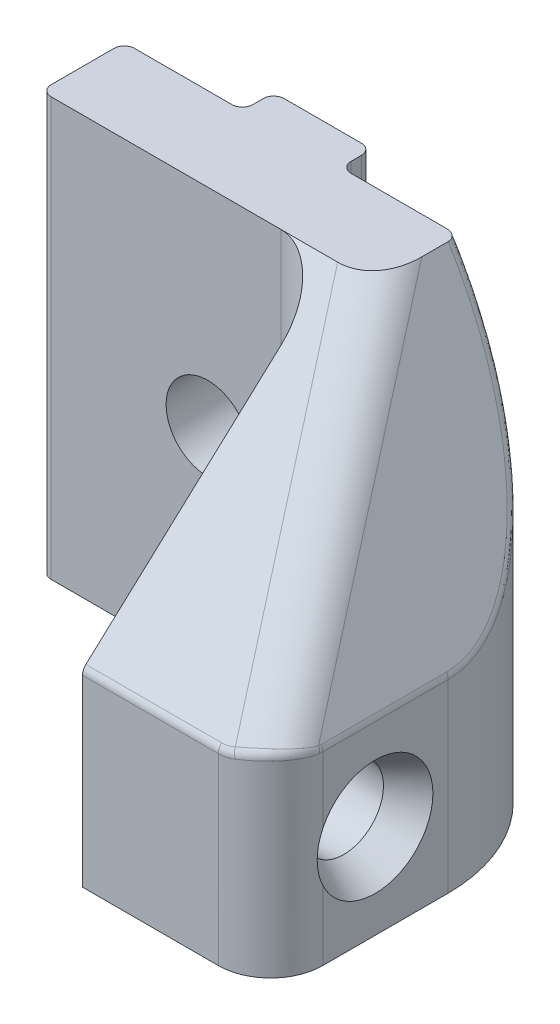
from build123d import *

# Parameters (mm, degrees)
BOSS_EXTRU_1_DEPTH           = 10
ENL_V_MAT_EXTRU_1_DEPTH      = 25.98113298
ENL_V_MAT_EXTRU_1_DEPTH_BACK = 25.98113298
ESQUISSE2_R                  = 2
ESQUISSE3_R                  = 1.55
ENL_V_MAT_EXTRU_2_DEPTH      = 24.494680249
ENL_V_START                  = -4
ESQUISSE4_R                  = 1.9
ENL_V_MAT_EXTRU_3_DEPTH      = 20.494680249
CHANFREIN1_SIZE              = 1.5
CHANFREIN1_SIZE2             = 0.866025404
CONG_1_R                     = 0.5
CONG_2_R                     = 2.5
CONG_3_R                     = 7.5
CONG_4_R                     = 0.5


with BuildPart() as part:
    # Esquisse1 → Boss.-Extru.1 (new, symmetric)
    with BuildSketch(Plane(origin=(0, 0, 0), x_dir=(1, 0, 0), z_dir=(0, 1, 0))):
        Polygon((2.35, 0), (15, 0), (15, -16), (6, -16), (6, -4), (-8, -4), (-8, 0), (-2.35, 0), (-2.35, 1.5), (2.35, 1.5), align=None)
    extrude(amount=BOSS_EXTRU_1_DEPTH, both=True)

    # Esquisse2 → Enlèv. mat.-Extru.1 (cut, two sides: drawn at the far end of the back side and taken through both)
    with BuildSketch(Plane(origin=(-1.372446517, 0, 0), x_dir=(1, 0, 0), z_dir=(0, 0, 1)).offset(-ENL_V_MAT_EXTRU_1_DEPTH_BACK)):
        with Locations((1.372446517, 0)):
            Circle(ESQUISSE2_R)
        Polygon((9.372446517, 10), (16.372446517, -1), (16.372446517, 10), align=None)
    extrude(amount=ENL_V_MAT_EXTRU_1_DEPTH + ENL_V_MAT_EXTRU_1_DEPTH_BACK, mode=Mode.SUBTRACT)

    # Esquisse3 → Enlèv. mat.-Extru.2 (cut, through all)
    with BuildSketch(Plane.ZY.offset(-6)):
        with Locations((11, -5.5)):
            Circle(ESQUISSE3_R)
        Polygon((16, 10), (16, -1), (4, 10), align=None)
    extrude(amount=-ENL_V_MAT_EXTRU_2_DEPTH, mode=Mode.SUBTRACT)

    # Esquisse4 → Enlèv. mat.-Extru.3 (cut, through all)
    with BuildSketch(Plane.ZY.offset(-6).offset(ENL_V_START)):
        with Locations((11, -5.5)):
            Circle(ESQUISSE4_R)
    extrude(amount=-ENL_V_MAT_EXTRU_3_DEPTH, mode=Mode.SUBTRACT)

    # Chanfrein1
    chanfrein1_edges = [part.edges().sort_by_distance(p)[0] for p in [
        (15, -5.5, 9.1),
    ]]
    chanfrein1_side = [part.faces().sort_by_distance(p)[0] for p in [
        (12.5, -5.5, 9.1),
    ]]
    chamfer(chanfrein1_edges, length=CHANFREIN1_SIZE, length2=CHANFREIN1_SIZE2, reference=chanfrein1_side[0])

    # Congé1
    # the kernel refuses this fillet: 0.5 mm, written as the material it adds along each edge
    with BuildSketch(Plane(origin=(2.35, -10, 0), x_dir=(1, 0, 0), z_dir=(0, 1, 0)), Plane(origin=(-2.35, 10, 0), x_dir=(-1, 0, 0), z_dir=(0, -1, 0))) as cong_1_piece_1:
        with BuildLine():
            CenterArc((CONG_1_R, CONG_1_R), CONG_1_R, 180, 90)
            Line((0, CONG_1_R), (0, 0))
            Line((0, 0), (CONG_1_R, 0))
        make_face()
    extrude(amount=20)
    # the kernel refuses this fillet: 0.5 mm, written as the material it takes off along each edge
    with BuildSketch(Plane(origin=(-2.35, -11.25, -1.5), x_dir=(0, 0, 1), z_dir=(0, 1, 0)), Plane(origin=(2.35, -11.25, -1.5), x_dir=(-1, 0, 0), z_dir=(0, 1, 0))) as cong_1_2_piece_1:
        with BuildLine():
            CenterArc((CONG_1_R, CONG_1_R), CONG_1_R, 180, 90)
            Line((0, CONG_1_R), (0, 0))
            Line((0, 0), (CONG_1_R, 0))
        make_face()
    extrude(amount=22.5, mode=Mode.SUBTRACT)
    with BuildSketch(Plane(origin=(-8, 11.25, 4), x_dir=(1, 0, 0), z_dir=(0, -1, 0)), Plane(origin=(-8, 11.25, 0), x_dir=(0, 0, 1), z_dir=(0, -1, 0))) as cong_1_2_piece_2:
        with BuildLine():
            CenterArc((CONG_1_R, -CONG_1_R), CONG_1_R, 90, 90)
            Line((0, -CONG_1_R), (0, 0))
            Line((0, 0), (CONG_1_R, 0))
        make_face()
    extrude(amount=22.5, mode=Mode.SUBTRACT)

    # Congé2
    # the kernel refuses this fillet: 2.5 mm, written as the material it adds along each edge
    with BuildSketch(Plane(origin=(6, 10, 4), x_dir=(-1, 0, 0), z_dir=(0, -1, 0))) as cong_2_piece_1_section:
        with BuildLine():
            CenterArc((CONG_2_R, -CONG_2_R), CONG_2_R, 90, 90)
            Line((0, -CONG_2_R), (0, 0))
            Line((0, 0), (CONG_2_R, 0))
        make_face()
    cong_2_piece_1 = extrude(amount=20, mode=Mode.PRIVATE)
    cong_2_piece_1 = split(cong_2_piece_1, bisect_by=Plane(origin=(5.425998809, 5.04278821, 9.407867407), z_dir=(0, -0.7371541402007414, -0.6757246285173464)), keep=Keep.TOP, mode=Mode.PRIVATE)
    add(cong_2_piece_1)
    # the kernel refuses this fillet: 2.5 mm, written as the material it takes off along each edge
    with BuildSketch(Plane(origin=(15, 5.25, 16), x_dir=(0, 0, -1), z_dir=(0, -1, 0))) as cong_2_2_piece_1:
        with BuildLine():
            CenterArc((CONG_2_R, -CONG_2_R), CONG_2_R, 90, 90)
            Line((0, -CONG_2_R), (0, 0))
            Line((0, 0), (CONG_2_R, 0))
        make_face()
    extrude(amount=21.5, mode=Mode.SUBTRACT)
    with BuildSketch(Plane(origin=(6.375526619, 12.552743885, 1.215188489), x_dir=(-0.9186669933038779, -0.26693342824301264, 0.2912001035378338), z_dir=(0.39503285358817025, -0.6207659127814106, 0.6771991775797204))) as cong_2_2_piece_2:
        with BuildLine():
            CenterArc((CONG_2_R * 0.657959809236, CONG_2_R), CONG_2_R, 203.313381237, 66.686618763)
            Line((-CONG_2_R * 0.260394168736, CONG_2_R * 0.604240008158), (0, 0))
            Line((0, 0), (CONG_2_R * 0.657959809236, 0))
        make_face()
    extrude(amount=25.944542762, mode=Mode.SUBTRACT)

    # Congé3
    cong_3_edges = [part.edges().sort_by_distance(p)[0] for p in [
        (15, -5.5, 0),
    ]]
    fillet(cong_3_edges, radius=CONG_3_R)

    # Congé4
    cong_4_edges = [part.edges().sort_by_distance(p)[0] for p in [
        (12.259253093, 3.306887997, 1.703491568),
        (15, -1, 10.5),
        (14.996996557, -0.995280305, 13.622507927),
        (14.411085818, -0.78571613, 15.111754011),
        (12.834334198, -0.979414662, 15.977543268),
        (9.25, -1, 16),
    ]]
    fillet(cong_4_edges, radius=CONG_4_R)


solid = part.part
